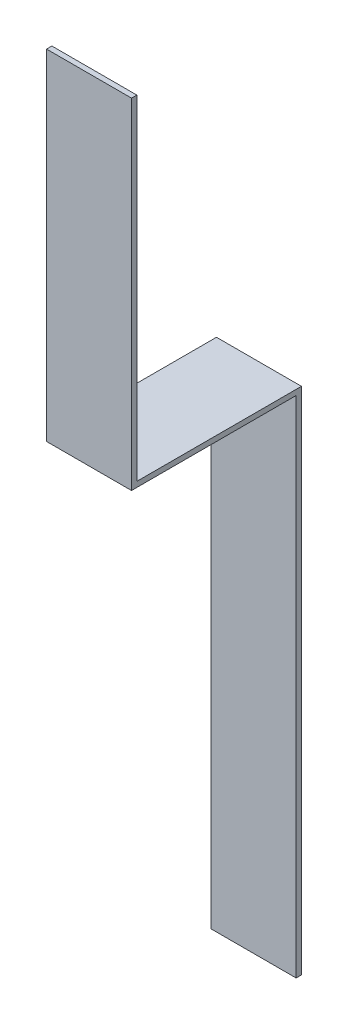
from build123d import *

# Parameters (mm, degrees)
BOSS_EXTRUDE1_DEPTH = 25.4


with BuildPart() as part:
    # Sketch3 → Boss-Extrude1 (new body)
    with BuildSketch(Plane(origin=(0, 0, 0), x_dir=(0, 0, -1), z_dir=(1, 0, 0))):
        Polygon((0, 0), (0, -101.6), (49.2125, -101.6), (49.2125, -252.4125), (50.8, -252.4125), (50.8, -100.0125), (1.5875, -100.0125), (1.5875, 0), align=None)
    extrude(amount=-BOSS_EXTRUDE1_DEPTH)


solid = part.part
